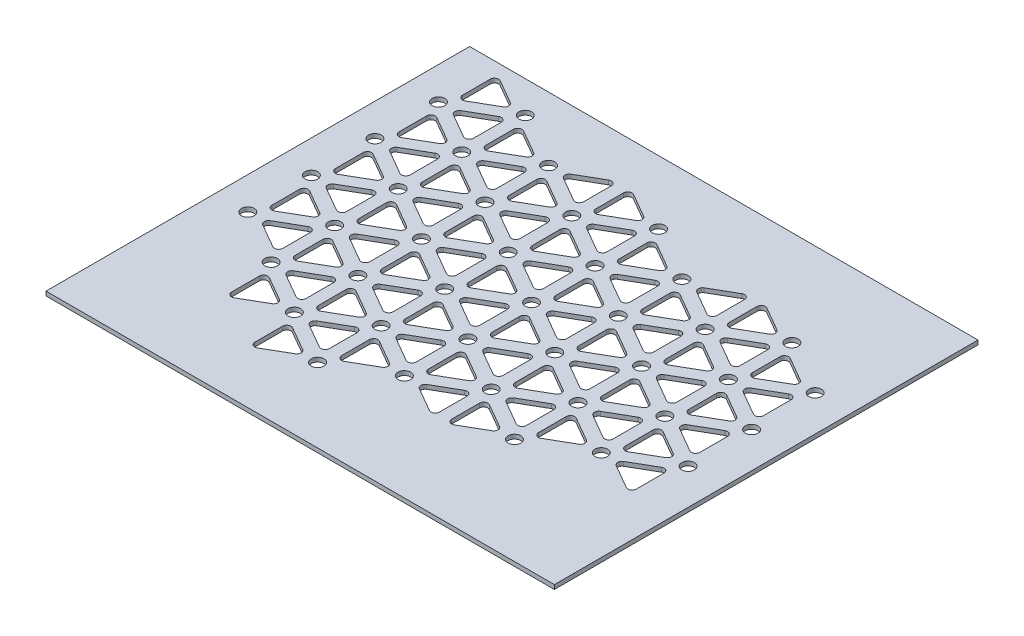
from build123d import *

# Parameters (mm, degrees)
SKETCH1_W               = 120
SKETCH1_H               = 100
BOSS_EXTRUDE1_DEPTH     = 1
CUT_EXTRUDE2_DEPTH      = 85.754448835
FILLET1_R               = 1
CUT_EXTRUDE3_DEPTH      = 85.754448835
FILLET3_R               = 1
SKETCH8_R               = 1.5
CUT_EXTRUDE4_DEPTH      = 85.754448835
FILL_PATTERN2_DEPTH     = 1
FILL_PATTERN3_DEPTH     = 1
FILL_PATTERN4_OUTLINE_R = 1.5
FILL_PATTERN4_DEPTH     = 1


# Read off the part's stored shape, not the designer's step: Fill Pattern2, Fill Pattern3, Fill Pattern4
with BuildPart() as part:
    # Sketch1 → Boss-Extrude1 (new body)
    with BuildSketch(Plane(origin=(0, 0, 0), x_dir=(1, 0, 0), z_dir=(0, 1, 0))):
        with Locations((2.258064516, 7.5)):
            Rectangle(SKETCH1_W, SKETCH1_H)
    extrude(amount=BOSS_EXTRUDE1_DEPTH)

    # Sketch5 → Cut-Extrude2 (cut, through all)
    with BuildSketch(Plane(origin=(0, 1, 0), x_dir=(1, 0, 0), z_dir=(0, 1, 0))):
        Polygon((-39.973726929, 49.978771562), (-48.633980967, 54.978771562), (-48.633980967, 44.978771562), align=None)
    extrude(amount=-CUT_EXTRUDE2_DEPTH, mode=Mode.SUBTRACT)

    # Fillet1
    fillet1_edges = [part.edges().sort_by_distance(p)[0] for p in [
        (-39.973726929, 0.5, -49.978771562),
        (-48.633980967, 0.5, -44.978771562),
        (-48.633980967, 0.5, -54.978771562),
    ]]
    fillet(fillet1_edges, radius=FILLET1_R)

    # Sketch6 → Cut-Extrude3 (cut, through all)
    with BuildSketch(Plane(origin=(0, 1, 0), x_dir=(1, 0, 0), z_dir=(0, 1, 0))):
        Polygon((-47.190605294, 42.478771562), (-38.530351256, 37.478771562), (-38.530351256, 47.478771562), align=None)
    extrude(amount=-CUT_EXTRUDE3_DEPTH, mode=Mode.SUBTRACT)

    # Fillet3
    fillet3_edges = [part.edges().sort_by_distance(p)[0] for p in [
        (-47.190605294, 0.5, -42.478771562),
        (-38.530351256, 0.5, -47.478771562),
        (-38.530351256, 0.5, -37.478771562),
    ]]
    fillet(fillet3_edges, radius=FILLET3_R)

    # Sketch8 → Cut-Extrude4 (cut, through all)
    with BuildSketch(Plane(origin=(0, 1, 0), x_dir=(1, 0, 0), z_dir=(0, 1, 0))):
        with Locations(Location((-37.086975583, 49.978771562, 0), (0, 0, 270))):
            Circle(SKETCH8_R)
    extrude(amount=-CUT_EXTRUDE4_DEPTH, mode=Mode.SUBTRACT)

    # Fill Pattern2 outline → Fill Pattern2 (cut)
    with BuildSketch(Plane(origin=(0, 0, 0), x_dir=(1, 0, 0), z_dir=(0, 1, 0))):
        with BuildLine():
            ThreePointArc((-47.133980967, 24.112746159), (-48.133980967, 24.112746159), (-48.633980967, 23.246720755))
            Line((-48.633980967, 23.246720755), (-48.633980967, 16.71082237))
            ThreePointArc((-48.633980967, 16.71082237), (-48.133980967, 15.844796966), (-47.133980967, 15.844796966))
            Line((-47.133980967, 15.844796966), (-41.473726929, 19.112746159))
            ThreePointArc((-41.473726929, 19.112746159), (-40.973726929, 19.978771563), (-41.473726929, 20.844796966))
            Line((-41.473726929, 20.844796966), (-47.133980967, 24.112746159))
        make_face()
        with BuildLine():
            ThreePointArc((-47.133980967, 9.112746159), (-48.133980967, 9.112746159), (-48.633980967, 8.246720755))
            Line((-48.633980967, 8.246720755), (-48.633980967, 1.71082237))
            ThreePointArc((-48.633980967, 1.71082237), (-48.133980967, 0.844796966), (-47.133980967, 0.844796966))
            Line((-47.133980967, 0.844796966), (-41.473726929, 4.112746159))
            ThreePointArc((-41.473726929, 4.112746159), (-40.973726929, 4.978771562), (-41.473726929, 5.844796966))
            Line((-41.473726929, 5.844796966), (-47.133980967, 9.112746159))
        make_face()
        with BuildLine():
            ThreePointArc((-47.133980967, 39.112746159), (-48.133980967, 39.112746159), (-48.633980967, 38.246720755))
            Line((-48.633980967, 38.246720755), (-48.633980967, 31.71082237))
            ThreePointArc((-48.633980967, 31.71082237), (-48.133980967, 30.844796966), (-47.133980967, 30.844796966))
            Line((-47.133980967, 30.844796966), (-41.473726929, 34.112746159))
            ThreePointArc((-41.473726929, 34.112746159), (-40.973726929, 34.978771563), (-41.473726929, 35.844796966))
            Line((-41.473726929, 35.844796966), (-47.133980967, 39.112746159))
        make_face()
        with BuildLine():
            ThreePointArc((-15.492964815, 34.112746159), (-14.992964815, 34.978771563), (-15.492964815, 35.844796966))
            Line((-15.492964815, 35.844796966), (-21.153218853, 39.112746159))
            ThreePointArc((-21.153218853, 39.112746159), (-22.153218853, 39.112746159), (-22.653218853, 38.246720755))
            Line((-22.653218853, 38.246720755), (-22.653218853, 31.71082237))
            ThreePointArc((-22.653218853, 31.71082237), (-22.153218853, 30.844796966), (-21.153218853, 30.844796966))
            Line((-21.153218853, 30.844796966), (-15.492964815, 34.112746159))
        make_face()
        with BuildLine():
            ThreePointArc((-28.483345872, 41.612746159), (-27.983345872, 42.478771563), (-28.483345872, 43.344796966))
            Line((-28.483345872, 43.344796966), (-34.14359991, 46.612746159))
            ThreePointArc((-34.14359991, 46.612746159), (-35.14359991, 46.612746159), (-35.64359991, 45.746720755))
            Line((-35.64359991, 45.746720755), (-35.64359991, 39.21082237))
            ThreePointArc((-35.64359991, 39.21082237), (-35.14359991, 38.344796966), (-34.14359991, 38.344796966))
            Line((-34.14359991, 38.344796966), (-28.483345872, 41.612746159))
        make_face()
        with BuildLine():
            ThreePointArc((49.458940468, -3.387253841), (49.958940468, -2.521228438), (49.458940468, -1.655203034))
            Line((49.458940468, -1.655203034), (43.798686431, 1.612746159))
            ThreePointArc((43.798686431, 1.612746159), (42.798686431, 1.612746159), (42.298686431, 0.746720755))
            Line((42.298686431, 0.746720755), (42.298686431, -5.78917763))
            ThreePointArc((42.298686431, -5.78917763), (42.798686431, -6.655203034), (43.798686431, -6.655203034))
            Line((43.798686431, -6.655203034), (49.458940468, -3.387253841))
        make_face()
        with BuildLine():
            ThreePointArc((36.468559412, 4.112746159), (36.968559412, 4.978771562), (36.468559412, 5.844796966))
            Line((36.468559412, 5.844796966), (30.808305374, 9.112746159))
            ThreePointArc((30.808305374, 9.112746159), (29.808305374, 9.112746159), (29.308305374, 8.246720755))
            Line((29.308305374, 8.246720755), (29.308305374, 1.71082237))
            ThreePointArc((29.308305374, 1.71082237), (29.808305374, 0.844796966), (30.808305374, 0.844796966))
            Line((30.808305374, 0.844796966), (36.468559412, 4.112746159))
        make_face()
        with BuildLine():
            ThreePointArc((23.478178355, 11.612746159), (23.978178355, 12.478771563), (23.478178355, 13.344796966))
            Line((23.478178355, 13.344796966), (17.817924317, 16.612746159))
            ThreePointArc((17.817924317, 16.612746159), (16.817924317, 16.612746159), (16.317924317, 15.746720755))
            Line((16.317924317, 15.746720755), (16.317924317, 9.21082237))
            ThreePointArc((16.317924317, 9.21082237), (16.817924317, 8.344796966), (17.817924317, 8.344796966))
            Line((17.817924317, 8.344796966), (23.478178355, 11.612746159))
        make_face()
        with BuildLine():
            ThreePointArc((10.487797298, 19.112746159), (10.987797298, 19.978771563), (10.487797298, 20.844796966))
            Line((10.487797298, 20.844796966), (4.82754326, 24.112746159))
            ThreePointArc((4.82754326, 24.112746159), (3.82754326, 24.112746159), (3.32754326, 23.246720755))
            Line((3.32754326, 23.246720755), (3.32754326, 16.71082237))
            ThreePointArc((3.32754326, 16.71082237), (3.82754326, 15.844796966), (4.82754326, 15.844796966))
            Line((4.82754326, 15.844796966), (10.487797298, 19.112746159))
        make_face()
        with BuildLine():
            ThreePointArc((-2.502583759, 26.612746159), (-2.002583759, 27.478771563), (-2.502583759, 28.344796966))
            Line((-2.502583759, 28.344796966), (-8.162837796, 31.612746159))
            ThreePointArc((-8.162837796, 31.612746159), (-9.162837796, 31.612746159), (-9.662837796, 30.746720755))
            Line((-9.662837796, 30.746720755), (-9.662837796, 24.21082237))
            ThreePointArc((-9.662837796, 24.21082237), (-9.162837796, 23.344796966), (-8.162837796, 23.344796966))
            Line((-8.162837796, 23.344796966), (-2.502583759, 26.612746159))
        make_face()
        with BuildLine():
            ThreePointArc((29.308305374, 31.71082237), (29.808305374, 30.844796966), (30.808305374, 30.844796966))
            Line((30.808305374, 30.844796966), (36.468559412, 34.112746159))
            ThreePointArc((36.468559412, 34.112746159), (36.968559412, 34.978771563), (36.468559412, 35.844796966))
            Line((36.468559412, 35.844796966), (30.808305374, 39.112746159))
            ThreePointArc((30.808305374, 39.112746159), (29.808305374, 39.112746159), (29.308305374, 38.246720755))
            Line((29.308305374, 38.246720755), (29.308305374, 31.71082237))
        make_face()
        with BuildLine():
            ThreePointArc((-22.653218853, 1.71082237), (-22.153218853, 0.844796966), (-21.153218853, 0.844796966))
            Line((-21.153218853, 0.844796966), (-15.492964815, 4.112746159))
            ThreePointArc((-15.492964815, 4.112746159), (-14.992964815, 4.978771562), (-15.492964815, 5.844796966))
            Line((-15.492964815, 5.844796966), (-21.153218853, 9.112746159))
            ThreePointArc((-21.153218853, 9.112746159), (-22.153218853, 9.112746159), (-22.653218853, 8.246720755))
            Line((-22.653218853, 8.246720755), (-22.653218853, 1.71082237))
        make_face()
        with BuildLine():
            ThreePointArc((-9.662837796, 9.21082237), (-9.162837796, 8.344796966), (-8.162837796, 8.344796966))
            Line((-8.162837796, 8.344796966), (-2.502583759, 11.612746159))
            ThreePointArc((-2.502583759, 11.612746159), (-2.002583759, 12.478771563), (-2.502583759, 13.344796966))
            Line((-2.502583759, 13.344796966), (-8.162837796, 16.612746159))
            ThreePointArc((-8.162837796, 16.612746159), (-9.162837796, 16.612746159), (-9.662837796, 15.746720755))
            Line((-9.662837796, 15.746720755), (-9.662837796, 9.21082237))
        make_face()
        with BuildLine():
            ThreePointArc((-35.64359991, -5.78917763), (-35.14359991, -6.655203034), (-34.14359991, -6.655203034))
            Line((-34.14359991, -6.655203034), (-28.483345872, -3.387253841))
            ThreePointArc((-28.483345872, -3.387253841), (-27.983345872, -2.521228438), (-28.483345872, -1.655203034))
            Line((-28.483345872, -1.655203034), (-34.14359991, 1.612746159))
            ThreePointArc((-34.14359991, 1.612746159), (-35.14359991, 1.612746159), (-35.64359991, 0.746720755))
            Line((-35.64359991, 0.746720755), (-35.64359991, -5.78917763))
        make_face()
        with BuildLine():
            ThreePointArc((16.317924317, 24.21082237), (16.817924317, 23.344796966), (17.817924317, 23.344796966))
            Line((17.817924317, 23.344796966), (23.478178355, 26.612746159))
            ThreePointArc((23.478178355, 26.612746159), (23.978178355, 27.478771563), (23.478178355, 28.344796966))
            Line((23.478178355, 28.344796966), (17.817924317, 31.612746159))
            ThreePointArc((17.817924317, 31.612746159), (16.817924317, 31.612746159), (16.317924317, 30.746720755))
            Line((16.317924317, 30.746720755), (16.317924317, 24.21082237))
        make_face()
        with BuildLine():
            ThreePointArc((30.808305374, -5.887253841), (29.808305374, -5.887253841), (29.308305374, -6.753279245))
            Line((29.308305374, -6.753279245), (29.308305374, -13.28917763))
            ThreePointArc((29.308305374, -13.28917763), (29.808305374, -14.155203034), (30.808305374, -14.155203034))
            Line((30.808305374, -14.155203034), (36.468559412, -10.887253841))
            ThreePointArc((36.468559412, -10.887253841), (36.968559412, -10.021228437), (36.468559412, -9.155203034))
            Line((36.468559412, -9.155203034), (30.808305374, -5.887253841))
        make_face()
        with BuildLine():
            ThreePointArc((30.808305374, 24.112746159), (29.808305374, 24.112746159), (29.308305374, 23.246720755))
            Line((29.308305374, 23.246720755), (29.308305374, 16.71082237))
            ThreePointArc((29.308305374, 16.71082237), (29.808305374, 15.844796966), (30.808305374, 15.844796966))
            Line((30.808305374, 15.844796966), (36.468559412, 19.112746159))
            ThreePointArc((36.468559412, 19.112746159), (36.968559412, 19.978771563), (36.468559412, 20.844796966))
            Line((36.468559412, 20.844796966), (30.808305374, 24.112746159))
        make_face()
        with BuildLine():
            ThreePointArc((49.458940468, 26.612746159), (49.958940468, 27.478771563), (49.458940468, 28.344796966))
            Line((49.458940468, 28.344796966), (43.798686431, 31.612746159))
            ThreePointArc((43.798686431, 31.612746159), (42.798686431, 31.612746159), (42.298686431, 30.746720755))
            Line((42.298686431, 30.746720755), (42.298686431, 24.21082237))
            ThreePointArc((42.298686431, 24.21082237), (42.798686431, 23.344796966), (43.798686431, 23.344796966))
            Line((43.798686431, 23.344796966), (49.458940468, 26.612746159))
        make_face()
        with BuildLine():
            ThreePointArc((-9.662837796, -5.78917763), (-9.162837796, -6.655203034), (-8.162837796, -6.655203034))
            Line((-8.162837796, -6.655203034), (-2.502583759, -3.387253841))
            ThreePointArc((-2.502583759, -3.387253841), (-2.002583759, -2.521228438), (-2.502583759, -1.655203034))
            Line((-2.502583759, -1.655203034), (-8.162837796, 1.612746159))
            ThreePointArc((-8.162837796, 1.612746159), (-9.162837796, 1.612746159), (-9.662837796, 0.746720755))
            Line((-9.662837796, 0.746720755), (-9.662837796, -5.78917763))
        make_face()
        with BuildLine():
            ThreePointArc((3.32754326, 1.71082237), (3.82754326, 0.844796966), (4.82754326, 0.844796966))
            Line((4.82754326, 0.844796966), (10.487797298, 4.112746159))
            ThreePointArc((10.487797298, 4.112746159), (10.987797298, 4.978771562), (10.487797298, 5.844796966))
            Line((10.487797298, 5.844796966), (4.82754326, 9.112746159))
            ThreePointArc((4.82754326, 9.112746159), (3.82754326, 9.112746159), (3.32754326, 8.246720755))
            Line((3.32754326, 8.246720755), (3.32754326, 1.71082237))
        make_face()
        with BuildLine():
            ThreePointArc((-22.653218853, -13.28917763), (-22.153218853, -14.155203034), (-21.153218853, -14.155203034))
            Line((-21.153218853, -14.155203034), (-15.492964815, -10.887253841))
            ThreePointArc((-15.492964815, -10.887253841), (-14.992964815, -10.021228437), (-15.492964815, -9.155203034))
            Line((-15.492964815, -9.155203034), (-21.153218853, -5.887253841))
            ThreePointArc((-21.153218853, -5.887253841), (-22.153218853, -5.887253841), (-22.653218853, -6.753279245))
            Line((-22.653218853, -6.753279245), (-22.653218853, -13.28917763))
        make_face()
        with BuildLine():
            ThreePointArc((-35.64359991, -20.78917763), (-35.14359991, -21.655203034), (-34.14359991, -21.655203034))
            Line((-34.14359991, -21.655203034), (-28.483345872, -18.387253841))
            ThreePointArc((-28.483345872, -18.387253841), (-27.983345872, -17.521228437), (-28.483345872, -16.655203034))
            Line((-28.483345872, -16.655203034), (-34.14359991, -13.387253841))
            ThreePointArc((-34.14359991, -13.387253841), (-35.14359991, -13.387253841), (-35.64359991, -14.253279245))
            Line((-35.64359991, -14.253279245), (-35.64359991, -20.78917763))
        make_face()
        with BuildLine():
            ThreePointArc((-8.162837796, -13.387253841), (-9.162837796, -13.387253841), (-9.662837796, -14.253279245))
            Line((-9.662837796, -14.253279245), (-9.662837796, -20.78917763))
            ThreePointArc((-9.662837796, -20.78917763), (-9.162837796, -21.655203034), (-8.162837796, -21.655203034))
            Line((-8.162837796, -21.655203034), (-2.502583759, -18.387253841))
            ThreePointArc((-2.502583759, -18.387253841), (-2.002583759, -17.521228437), (-2.502583759, -16.655203034))
            Line((-2.502583759, -16.655203034), (-8.162837796, -13.387253841))
        make_face()
        with BuildLine():
            ThreePointArc((-8.162837796, 46.612746159), (-9.162837796, 46.612746159), (-9.662837796, 45.746720755))
            Line((-9.662837796, 45.746720755), (-9.662837796, 39.21082237))
            ThreePointArc((-9.662837796, 39.21082237), (-9.162837796, 38.344796966), (-8.162837796, 38.344796966))
            Line((-8.162837796, 38.344796966), (-2.502583759, 41.612746159))
            ThreePointArc((-2.502583759, 41.612746159), (-2.002583759, 42.478771563), (-2.502583759, 43.344796966))
            Line((-2.502583759, 43.344796966), (-8.162837796, 46.612746159))
        make_face()
        with BuildLine():
            ThreePointArc((-28.483345872, 11.612746159), (-27.983345872, 12.478771563), (-28.483345872, 13.344796966))
            Line((-28.483345872, 13.344796966), (-34.14359991, 16.612746159))
            ThreePointArc((-34.14359991, 16.612746159), (-35.14359991, 16.612746159), (-35.64359991, 15.746720755))
            Line((-35.64359991, 15.746720755), (-35.64359991, 9.21082237))
            ThreePointArc((-35.64359991, 9.21082237), (-35.14359991, 8.344796966), (-34.14359991, 8.344796966))
            Line((-34.14359991, 8.344796966), (-28.483345872, 11.612746159))
        make_face()
        with BuildLine():
            ThreePointArc((23.478178355, -18.387253841), (23.978178355, -17.521228437), (23.478178355, -16.655203034))
            Line((23.478178355, -16.655203034), (17.817924317, -13.387253841))
            ThreePointArc((17.817924317, -13.387253841), (16.817924317, -13.387253841), (16.317924317, -14.253279245))
            Line((16.317924317, -14.253279245), (16.317924317, -20.78917763))
            ThreePointArc((16.317924317, -20.78917763), (16.817924317, -21.655203034), (17.817924317, -21.655203034))
            Line((17.817924317, -21.655203034), (23.478178355, -18.387253841))
        make_face()
        with BuildLine():
            ThreePointArc((10.487797298, -10.887253841), (10.987797298, -10.021228437), (10.487797298, -9.155203034))
            Line((10.487797298, -9.155203034), (4.82754326, -5.887253841))
            ThreePointArc((4.82754326, -5.887253841), (3.82754326, -5.887253841), (3.32754326, -6.753279245))
            Line((3.32754326, -6.753279245), (3.32754326, -13.28917763))
            ThreePointArc((3.32754326, -13.28917763), (3.82754326, -14.155203034), (4.82754326, -14.155203034))
            Line((4.82754326, -14.155203034), (10.487797298, -10.887253841))
        make_face()
        with BuildLine():
            ThreePointArc((-21.153218853, -20.887253841), (-22.153218853, -20.887253841), (-22.653218853, -21.753279245))
            Line((-22.653218853, -21.753279245), (-22.653218853, -28.28917763))
            ThreePointArc((-22.653218853, -28.28917763), (-22.153218853, -29.155203034), (-21.153218853, -29.155203034))
            Line((-21.153218853, -29.155203034), (-15.492964815, -25.887253841))
            ThreePointArc((-15.492964815, -25.887253841), (-14.992964815, -25.021228437), (-15.492964815, -24.155203034))
            Line((-15.492964815, -24.155203034), (-21.153218853, -20.887253841))
        make_face()
        with BuildLine():
            ThreePointArc((-21.153218853, 24.112746159), (-22.153218853, 24.112746159), (-22.653218853, 23.246720755))
            Line((-22.653218853, 23.246720755), (-22.653218853, 16.71082237))
            ThreePointArc((-22.653218853, 16.71082237), (-22.153218853, 15.844796966), (-21.153218853, 15.844796966))
            Line((-21.153218853, 15.844796966), (-15.492964815, 19.112746159))
            ThreePointArc((-15.492964815, 19.112746159), (-14.992964815, 19.978771563), (-15.492964815, 20.844796966))
            Line((-15.492964815, 20.844796966), (-21.153218853, 24.112746159))
        make_face()
        with BuildLine():
            ThreePointArc((3.32754326, 31.71082237), (3.82754326, 30.844796966), (4.82754326, 30.844796966))
            Line((4.82754326, 30.844796966), (10.487797298, 34.112746159))
            ThreePointArc((10.487797298, 34.112746159), (10.987797298, 34.978771563), (10.487797298, 35.844796966))
            Line((10.487797298, 35.844796966), (4.82754326, 39.112746159))
            ThreePointArc((4.82754326, 39.112746159), (3.82754326, 39.112746159), (3.32754326, 38.246720755))
            Line((3.32754326, 38.246720755), (3.32754326, 31.71082237))
        make_face()
        with BuildLine():
            ThreePointArc((-34.14359991, 31.612746159), (-35.14359991, 31.612746159), (-35.64359991, 30.746720755))
            Line((-35.64359991, 30.746720755), (-35.64359991, 24.21082237))
            ThreePointArc((-35.64359991, 24.21082237), (-35.14359991, 23.344796966), (-34.14359991, 23.344796966))
            Line((-34.14359991, 23.344796966), (-28.483345872, 26.612746159))
            ThreePointArc((-28.483345872, 26.612746159), (-27.983345872, 27.478771563), (-28.483345872, 28.344796966))
            Line((-28.483345872, 28.344796966), (-34.14359991, 31.612746159))
        make_face()
        with BuildLine():
            ThreePointArc((23.478178355, -3.387253841), (23.978178355, -2.521228438), (23.478178355, -1.655203034))
            Line((23.478178355, -1.655203034), (17.817924317, 1.612746159))
            ThreePointArc((17.817924317, 1.612746159), (16.817924317, 1.612746159), (16.317924317, 0.746720755))
            Line((16.317924317, 0.746720755), (16.317924317, -5.78917763))
            ThreePointArc((16.317924317, -5.78917763), (16.817924317, -6.655203034), (17.817924317, -6.655203034))
            Line((17.817924317, -6.655203034), (23.478178355, -3.387253841))
        make_face()
        with BuildLine():
            ThreePointArc((42.298686431, 9.21082237), (42.798686431, 8.344796966), (43.798686431, 8.344796966))
            Line((43.798686431, 8.344796966), (49.458940468, 11.612746159))
            ThreePointArc((49.458940468, 11.612746159), (49.958940468, 12.478771563), (49.458940468, 13.344796966))
            Line((49.458940468, 13.344796966), (43.798686431, 16.612746159))
            ThreePointArc((43.798686431, 16.612746159), (42.798686431, 16.612746159), (42.298686431, 15.746720755))
            Line((42.298686431, 15.746720755), (42.298686431, 9.21082237))
        make_face()
    extrude(amount=FILL_PATTERN2_DEPTH, mode=Mode.SUBTRACT)

    # Fill Pattern3 outline → Fill Pattern3 (cut)
    with BuildSketch(Plane(origin=(0, 0, 0), x_dir=(1, 0, 0), z_dir=(0, 1, 0))):
        with BuildLine():
            ThreePointArc((-40.030351256, 8.344796966), (-39.030351256, 8.344796966), (-38.530351256, 9.21082237))
            Line((-38.530351256, 9.21082237), (-38.530351256, 15.746720755))
            ThreePointArc((-38.530351256, 15.746720755), (-39.030351256, 16.612746159), (-40.030351256, 16.612746159))
            Line((-40.030351256, 16.612746159), (-45.690605294, 13.344796966))
            ThreePointArc((-45.690605294, 13.344796966), (-46.190605294, 12.478771563), (-45.690605294, 11.612746159))
            Line((-45.690605294, 11.612746159), (-40.030351256, 8.344796966))
        make_face()
        with BuildLine():
            ThreePointArc((-40.030351256, -6.655203034), (-39.030351256, -6.655203034), (-38.530351256, -5.78917763))
            Line((-38.530351256, -5.78917763), (-38.530351256, 0.746720755))
            ThreePointArc((-38.530351256, 0.746720755), (-39.030351256, 1.612746159), (-40.030351256, 1.612746159))
            Line((-40.030351256, 1.612746159), (-45.690605294, -1.655203034))
            ThreePointArc((-45.690605294, -1.655203034), (-46.190605294, -2.521228438), (-45.690605294, -3.387253841))
            Line((-45.690605294, -3.387253841), (-40.030351256, -6.655203034))
        make_face()
        with BuildLine():
            ThreePointArc((-40.030351256, 23.344796966), (-39.030351256, 23.344796966), (-38.530351256, 24.21082237))
            Line((-38.530351256, 24.21082237), (-38.530351256, 30.746720755))
            ThreePointArc((-38.530351256, 30.746720755), (-39.030351256, 31.612746159), (-40.030351256, 31.612746159))
            Line((-40.030351256, 31.612746159), (-45.690605294, 28.344796966))
            ThreePointArc((-45.690605294, 28.344796966), (-46.190605294, 27.478771563), (-45.690605294, 26.612746159))
            Line((-45.690605294, 26.612746159), (-40.030351256, 23.344796966))
        make_face()
        with BuildLine():
            ThreePointArc((19.26129999, 5.844796966), (18.76129999, 4.978771562), (19.26129999, 4.112746159))
            Line((19.26129999, 4.112746159), (24.921554028, 0.844796966))
            ThreePointArc((24.921554028, 0.844796966), (25.921554028, 0.844796966), (26.421554028, 1.71082237))
            Line((26.421554028, 1.71082237), (26.421554028, 8.246720755))
            ThreePointArc((26.421554028, 8.246720755), (25.921554028, 9.112746159), (24.921554028, 9.112746159))
            Line((24.921554028, 9.112746159), (19.26129999, 5.844796966))
        make_face()
        with BuildLine():
            ThreePointArc((32.251681047, -1.655203034), (31.751681047, -2.521228438), (32.251681047, -3.387253841))
            Line((32.251681047, -3.387253841), (37.911935085, -6.655203034))
            ThreePointArc((37.911935085, -6.655203034), (38.911935085, -6.655203034), (39.411935085, -5.78917763))
            Line((39.411935085, -5.78917763), (39.411935085, 0.746720755))
            ThreePointArc((39.411935085, 0.746720755), (38.911935085, 1.612746159), (37.911935085, 1.612746159))
            Line((37.911935085, 1.612746159), (32.251681047, -1.655203034))
        make_face()
        with BuildLine():
            ThreePointArc((45.242062104, -9.155203034), (44.742062104, -10.021228437), (45.242062104, -10.887253841))
            Line((45.242062104, -10.887253841), (50.902316141, -14.155203034))
            ThreePointArc((50.902316141, -14.155203034), (51.902316141, -14.155203034), (52.402316141, -13.28917763))
            Line((52.402316141, -13.28917763), (52.402316141, -6.753279245))
            ThreePointArc((52.402316141, -6.753279245), (51.902316141, -5.887253841), (50.902316141, -5.887253841))
            Line((50.902316141, -5.887253841), (45.242062104, -9.155203034))
        make_face()
        with BuildLine():
            ThreePointArc((6.270918933, 13.344796966), (5.770918933, 12.478771563), (6.270918933, 11.612746159))
            Line((6.270918933, 11.612746159), (11.931172971, 8.344796966))
            ThreePointArc((11.931172971, 8.344796966), (12.931172971, 8.344796966), (13.431172971, 9.21082237))
            Line((13.431172971, 9.21082237), (13.431172971, 15.746720755))
            ThreePointArc((13.431172971, 15.746720755), (12.931172971, 16.612746159), (11.931172971, 16.612746159))
            Line((11.931172971, 16.612746159), (6.270918933, 13.344796966))
        make_face()
        with BuildLine():
            ThreePointArc((-6.719462123, 20.844796966), (-7.219462123, 19.978771563), (-6.719462123, 19.112746159))
            Line((-6.719462123, 19.112746159), (-1.059208086, 15.844796966))
            ThreePointArc((-1.059208086, 15.844796966), (-0.059208086, 15.844796966), (0.440791914, 16.71082237))
            Line((0.440791914, 16.71082237), (0.440791914, 23.246720755))
            ThreePointArc((0.440791914, 23.246720755), (-0.059208086, 24.112746159), (-1.059208086, 24.112746159))
            Line((-1.059208086, 24.112746159), (-6.719462123, 20.844796966))
        make_face()
        with BuildLine():
            ThreePointArc((-19.70984318, 28.344796966), (-20.20984318, 27.478771563), (-19.70984318, 26.612746159))
            Line((-19.70984318, 26.612746159), (-14.049589142, 23.344796966))
            ThreePointArc((-14.049589142, 23.344796966), (-13.049589142, 23.344796966), (-12.549589142, 24.21082237))
            Line((-12.549589142, 24.21082237), (-12.549589142, 30.746720755))
            ThreePointArc((-12.549589142, 30.746720755), (-13.049589142, 31.612746159), (-14.049589142, 31.612746159))
            Line((-14.049589142, 31.612746159), (-19.70984318, 28.344796966))
        make_face()
        with BuildLine():
            ThreePointArc((-32.700224237, 35.844796966), (-33.200224237, 34.978771563), (-32.700224237, 34.112746159))
            Line((-32.700224237, 34.112746159), (-27.039970199, 30.844796966))
            ThreePointArc((-27.039970199, 30.844796966), (-26.039970199, 30.844796966), (-25.539970199, 31.71082237))
            Line((-25.539970199, 31.71082237), (-25.539970199, 38.246720755))
            ThreePointArc((-25.539970199, 38.246720755), (-26.039970199, 39.112746159), (-27.039970199, 39.112746159))
            Line((-27.039970199, 39.112746159), (-32.700224237, 35.844796966))
        make_face()
        with BuildLine():
            ThreePointArc((26.421554028, 38.246720755), (25.921554028, 39.112746159), (24.921554028, 39.112746159))
            Line((24.921554028, 39.112746159), (19.26129999, 35.844796966))
            ThreePointArc((19.26129999, 35.844796966), (18.76129999, 34.978771563), (19.26129999, 34.112746159))
            Line((19.26129999, 34.112746159), (24.921554028, 30.844796966))
            ThreePointArc((24.921554028, 30.844796966), (25.921554028, 30.844796966), (26.421554028, 31.71082237))
            Line((26.421554028, 31.71082237), (26.421554028, 38.246720755))
        make_face()
        with BuildLine():
            ThreePointArc((-25.539970199, 8.246720755), (-26.039970199, 9.112746159), (-27.039970199, 9.112746159))
            Line((-27.039970199, 9.112746159), (-32.700224237, 5.844796966))
            ThreePointArc((-32.700224237, 5.844796966), (-33.200224237, 4.978771562), (-32.700224237, 4.112746159))
            Line((-32.700224237, 4.112746159), (-27.039970199, 0.844796966))
            ThreePointArc((-27.039970199, 0.844796966), (-26.039970199, 0.844796966), (-25.539970199, 1.71082237))
            Line((-25.539970199, 1.71082237), (-25.539970199, 8.246720755))
        make_face()
        with BuildLine():
            ThreePointArc((-12.549589142, 15.746720755), (-13.049589142, 16.612746159), (-14.049589142, 16.612746159))
            Line((-14.049589142, 16.612746159), (-19.70984318, 13.344796966))
            ThreePointArc((-19.70984318, 13.344796966), (-20.20984318, 12.478771563), (-19.70984318, 11.612746159))
            Line((-19.70984318, 11.612746159), (-14.049589142, 8.344796966))
            ThreePointArc((-14.049589142, 8.344796966), (-13.049589142, 8.344796966), (-12.549589142, 9.21082237))
            Line((-12.549589142, 9.21082237), (-12.549589142, 15.746720755))
        make_face()
        with BuildLine():
            ThreePointArc((13.431172971, 30.746720755), (12.931172971, 31.612746159), (11.931172971, 31.612746159))
            Line((11.931172971, 31.612746159), (6.270918933, 28.344796966))
            ThreePointArc((6.270918933, 28.344796966), (5.770918933, 27.478771563), (6.270918933, 26.612746159))
            Line((6.270918933, 26.612746159), (11.931172971, 23.344796966))
            ThreePointArc((11.931172971, 23.344796966), (12.931172971, 23.344796966), (13.431172971, 24.21082237))
            Line((13.431172971, 24.21082237), (13.431172971, 30.746720755))
        make_face()
        with BuildLine():
            ThreePointArc((24.921554028, -14.155203034), (25.921554028, -14.155203034), (26.421554028, -13.28917763))
            Line((26.421554028, -13.28917763), (26.421554028, -6.753279245))
            ThreePointArc((26.421554028, -6.753279245), (25.921554028, -5.887253841), (24.921554028, -5.887253841))
            Line((24.921554028, -5.887253841), (19.26129999, -9.155203034))
            ThreePointArc((19.26129999, -9.155203034), (18.76129999, -10.021228437), (19.26129999, -10.887253841))
            Line((19.26129999, -10.887253841), (24.921554028, -14.155203034))
        make_face()
        with BuildLine():
            ThreePointArc((24.921554028, 15.844796966), (25.921554028, 15.844796966), (26.421554028, 16.71082237))
            Line((26.421554028, 16.71082237), (26.421554028, 23.246720755))
            ThreePointArc((26.421554028, 23.246720755), (25.921554028, 24.112746159), (24.921554028, 24.112746159))
            Line((24.921554028, 24.112746159), (19.26129999, 20.844796966))
            ThreePointArc((19.26129999, 20.844796966), (18.76129999, 19.978771563), (19.26129999, 19.112746159))
            Line((19.26129999, 19.112746159), (24.921554028, 15.844796966))
        make_face()
        with BuildLine():
            ThreePointArc((45.242062104, 20.844796966), (44.742062104, 19.978771563), (45.242062104, 19.112746159))
            Line((45.242062104, 19.112746159), (50.902316141, 15.844796966))
            ThreePointArc((50.902316141, 15.844796966), (51.902316141, 15.844796966), (52.402316141, 16.71082237))
            Line((52.402316141, 16.71082237), (52.402316141, 23.246720755))
            ThreePointArc((52.402316141, 23.246720755), (51.902316141, 24.112746159), (50.902316141, 24.112746159))
            Line((50.902316141, 24.112746159), (45.242062104, 20.844796966))
        make_face()
        with BuildLine():
            ThreePointArc((32.251681047, 28.344796966), (31.751681047, 27.478771563), (32.251681047, 26.612746159))
            Line((32.251681047, 26.612746159), (37.911935085, 23.344796966))
            ThreePointArc((37.911935085, 23.344796966), (38.911935085, 23.344796966), (39.411935085, 24.21082237))
            Line((39.411935085, 24.21082237), (39.411935085, 30.746720755))
            ThreePointArc((39.411935085, 30.746720755), (38.911935085, 31.612746159), (37.911935085, 31.612746159))
            Line((37.911935085, 31.612746159), (32.251681047, 28.344796966))
        make_face()
        with BuildLine():
            ThreePointArc((13.431172971, -14.253279245), (12.931172971, -13.387253841), (11.931172971, -13.387253841))
            Line((11.931172971, -13.387253841), (6.270918933, -16.655203034))
            ThreePointArc((6.270918933, -16.655203034), (5.770918933, -17.521228437), (6.270918933, -18.387253841))
            Line((6.270918933, -18.387253841), (11.931172971, -21.655203034))
            ThreePointArc((11.931172971, -21.655203034), (12.931172971, -21.655203034), (13.431172971, -20.78917763))
            Line((13.431172971, -20.78917763), (13.431172971, -14.253279245))
        make_face()
        with BuildLine():
            ThreePointArc((52.402316141, 8.246720755), (51.902316141, 9.112746159), (50.902316141, 9.112746159))
            Line((50.902316141, 9.112746159), (45.242062104, 5.844796966))
            ThreePointArc((45.242062104, 5.844796966), (44.742062104, 4.978771562), (45.242062104, 4.112746159))
            Line((45.242062104, 4.112746159), (50.902316141, 0.844796966))
            ThreePointArc((50.902316141, 0.844796966), (51.902316141, 0.844796966), (52.402316141, 1.71082237))
            Line((52.402316141, 1.71082237), (52.402316141, 8.246720755))
        make_face()
        with BuildLine():
            ThreePointArc((6.270918933, -1.655203034), (5.770918933, -2.521228438), (6.270918933, -3.387253841))
            Line((6.270918933, -3.387253841), (11.931172971, -6.655203034))
            ThreePointArc((11.931172971, -6.655203034), (12.931172971, -6.655203034), (13.431172971, -5.78917763))
            Line((13.431172971, -5.78917763), (13.431172971, 0.746720755))
            ThreePointArc((13.431172971, 0.746720755), (12.931172971, 1.612746159), (11.931172971, 1.612746159))
            Line((11.931172971, 1.612746159), (6.270918933, -1.655203034))
        make_face()
        with BuildLine():
            ThreePointArc((-6.719462123, 5.844796966), (-7.219462123, 4.978771562), (-6.719462123, 4.112746159))
            Line((-6.719462123, 4.112746159), (-1.059208086, 0.844796966))
            ThreePointArc((-1.059208086, 0.844796966), (-0.059208086, 0.844796966), (0.440791914, 1.71082237))
            Line((0.440791914, 1.71082237), (0.440791914, 8.246720755))
            ThreePointArc((0.440791914, 8.246720755), (-0.059208086, 9.112746159), (-1.059208086, 9.112746159))
            Line((-1.059208086, 9.112746159), (-6.719462123, 5.844796966))
        make_face()
        with BuildLine():
            ThreePointArc((-32.700224237, 20.844796966), (-33.200224237, 19.978771563), (-32.700224237, 19.112746159))
            Line((-32.700224237, 19.112746159), (-27.039970199, 15.844796966))
            ThreePointArc((-27.039970199, 15.844796966), (-26.039970199, 15.844796966), (-25.539970199, 16.71082237))
            Line((-25.539970199, 16.71082237), (-25.539970199, 23.246720755))
            ThreePointArc((-25.539970199, 23.246720755), (-26.039970199, 24.112746159), (-27.039970199, 24.112746159))
            Line((-27.039970199, 24.112746159), (-32.700224237, 20.844796966))
        make_face()
        with BuildLine():
            ThreePointArc((0.440791914, 38.246720755), (-0.059208086, 39.112746159), (-1.059208086, 39.112746159))
            Line((-1.059208086, 39.112746159), (-6.719462123, 35.844796966))
            ThreePointArc((-6.719462123, 35.844796966), (-7.219462123, 34.978771563), (-6.719462123, 34.112746159))
            Line((-6.719462123, 34.112746159), (-1.059208086, 30.844796966))
            ThreePointArc((-1.059208086, 30.844796966), (-0.059208086, 30.844796966), (0.440791914, 31.71082237))
            Line((0.440791914, 31.71082237), (0.440791914, 38.246720755))
        make_face()
        with BuildLine():
            ThreePointArc((-19.70984318, -1.655203034), (-20.20984318, -2.521228438), (-19.70984318, -3.387253841))
            Line((-19.70984318, -3.387253841), (-14.049589142, -6.655203034))
            ThreePointArc((-14.049589142, -6.655203034), (-13.049589142, -6.655203034), (-12.549589142, -5.78917763))
            Line((-12.549589142, -5.78917763), (-12.549589142, 0.746720755))
            ThreePointArc((-12.549589142, 0.746720755), (-13.049589142, 1.612746159), (-14.049589142, 1.612746159))
            Line((-14.049589142, 1.612746159), (-19.70984318, -1.655203034))
        make_face()
        with BuildLine():
            ThreePointArc((-6.719462123, -9.155203034), (-7.219462123, -10.021228437), (-6.719462123, -10.887253841))
            Line((-6.719462123, -10.887253841), (-1.059208086, -14.155203034))
            ThreePointArc((-1.059208086, -14.155203034), (-0.059208086, -14.155203034), (0.440791914, -13.28917763))
            Line((0.440791914, -13.28917763), (0.440791914, -6.753279245))
            ThreePointArc((0.440791914, -6.753279245), (-0.059208086, -5.887253841), (-1.059208086, -5.887253841))
            Line((-1.059208086, -5.887253841), (-6.719462123, -9.155203034))
        make_face()
        with BuildLine():
            ThreePointArc((-27.039970199, -14.155203034), (-26.039970199, -14.155203034), (-25.539970199, -13.28917763))
            Line((-25.539970199, -13.28917763), (-25.539970199, -6.753279245))
            ThreePointArc((-25.539970199, -6.753279245), (-26.039970199, -5.887253841), (-27.039970199, -5.887253841))
            Line((-27.039970199, -5.887253841), (-32.700224237, -9.155203034))
            ThreePointArc((-32.700224237, -9.155203034), (-33.200224237, -10.021228437), (-32.700224237, -10.887253841))
            Line((-32.700224237, -10.887253841), (-27.039970199, -14.155203034))
        make_face()
        with BuildLine():
            ThreePointArc((-14.049589142, -21.655203034), (-13.049589142, -21.655203034), (-12.549589142, -20.78917763))
            Line((-12.549589142, -20.78917763), (-12.549589142, -14.253279245))
            ThreePointArc((-12.549589142, -14.253279245), (-13.049589142, -13.387253841), (-14.049589142, -13.387253841))
            Line((-14.049589142, -13.387253841), (-19.70984318, -16.655203034))
            ThreePointArc((-19.70984318, -16.655203034), (-20.20984318, -17.521228437), (-19.70984318, -18.387253841))
            Line((-19.70984318, -18.387253841), (-14.049589142, -21.655203034))
        make_face()
        with BuildLine():
            ThreePointArc((-14.049589142, 38.344796966), (-13.049589142, 38.344796966), (-12.549589142, 39.21082237))
            Line((-12.549589142, 39.21082237), (-12.549589142, 45.746720755))
            ThreePointArc((-12.549589142, 45.746720755), (-13.049589142, 46.612746159), (-14.049589142, 46.612746159))
            Line((-14.049589142, 46.612746159), (-19.70984318, 43.344796966))
            ThreePointArc((-19.70984318, 43.344796966), (-20.20984318, 42.478771563), (-19.70984318, 41.612746159))
            Line((-19.70984318, 41.612746159), (-14.049589142, 38.344796966))
        make_face()
        with BuildLine():
            ThreePointArc((39.411935085, 15.746720755), (38.911935085, 16.612746159), (37.911935085, 16.612746159))
            Line((37.911935085, 16.612746159), (32.251681047, 13.344796966))
            ThreePointArc((32.251681047, 13.344796966), (31.751681047, 12.478771563), (32.251681047, 11.612746159))
            Line((32.251681047, 11.612746159), (37.911935085, 8.344796966))
            ThreePointArc((37.911935085, 8.344796966), (38.911935085, 8.344796966), (39.411935085, 9.21082237))
            Line((39.411935085, 9.21082237), (39.411935085, 15.746720755))
        make_face()
    extrude(amount=FILL_PATTERN3_DEPTH, mode=Mode.SUBTRACT)

    # Fill Pattern4 outline → Fill Pattern4 (cut)
    with BuildSketch(Plane(origin=(0, 0, 0), x_dir=(1, 0, 0), z_dir=(0, 1, 0))):
        with Locations((40.855310758, 34.978771562)):
            Circle(FILL_PATTERN4_OUTLINE_R)
        with Locations((-11.106213469, -25.021228438)):
            Circle(FILL_PATTERN4_OUTLINE_R)
        with Locations((1.884167587, -17.521228438)):
            Circle(FILL_PATTERN4_OUTLINE_R)
        with Locations((-50.07735664, -2.521228438)):
            Circle(FILL_PATTERN4_OUTLINE_R)
        with Locations((-37.086975583, -10.021228438)):
            Circle(FILL_PATTERN4_OUTLINE_R)
        with Locations((-24.096594526, -17.521228438)):
            Circle(FILL_PATTERN4_OUTLINE_R)
        with Locations((1.884167587, 27.478771562)):
            Circle(FILL_PATTERN4_OUTLINE_R)
        with Locations((14.874548644, 19.978771562)):
            Circle(FILL_PATTERN4_OUTLINE_R)
        with Locations((27.864929701, 12.478771562)):
            Circle(FILL_PATTERN4_OUTLINE_R)
        with Locations((40.855310758, 4.978771562)):
            Circle(FILL_PATTERN4_OUTLINE_R)
        with Locations((-24.096594526, 27.478771562)):
            Circle(FILL_PATTERN4_OUTLINE_R)
        with Locations((-37.086975583, 34.978771562)):
            Circle(FILL_PATTERN4_OUTLINE_R)
        with Locations((-50.07735664, 42.478771562)):
            Circle(FILL_PATTERN4_OUTLINE_R)
        with Locations((53.845691814, -2.521228438)):
            Circle(FILL_PATTERN4_OUTLINE_R)
        with Locations((27.864929701, 27.478771562)):
            Circle(FILL_PATTERN4_OUTLINE_R)
        with Locations((14.874548644, 34.978771562)):
            Circle(FILL_PATTERN4_OUTLINE_R)
        with Locations((1.884167587, 42.478771562)):
            Circle(FILL_PATTERN4_OUTLINE_R)
        with Locations((53.845691814, 27.478771562)):
            Circle(FILL_PATTERN4_OUTLINE_R)
        with Locations((40.855310758, 19.978771562)):
            Circle(FILL_PATTERN4_OUTLINE_R)
        with Locations((53.845691814, 12.478771562)):
            Circle(FILL_PATTERN4_OUTLINE_R)
        with Locations((-24.096594526, 42.478771562)):
            Circle(FILL_PATTERN4_OUTLINE_R)
        with Locations((-11.106213469, 34.978771562)):
            Circle(FILL_PATTERN4_OUTLINE_R)
        with Locations((-11.106213469, 4.978771562)):
            Circle(FILL_PATTERN4_OUTLINE_R)
        with Locations((1.884167587, -2.521228438)):
            Circle(FILL_PATTERN4_OUTLINE_R)
        with Locations((14.874548644, -10.021228438)):
            Circle(FILL_PATTERN4_OUTLINE_R)
        with Locations((27.864929701, -17.521228438)):
            Circle(FILL_PATTERN4_OUTLINE_R)
        with Locations((-50.07735664, 12.478771562)):
            Circle(FILL_PATTERN4_OUTLINE_R)
        with Locations((-37.086975583, 4.978771562)):
            Circle(FILL_PATTERN4_OUTLINE_R)
        with Locations((-24.096594526, -2.521228438)):
            Circle(FILL_PATTERN4_OUTLINE_R)
        with Locations((-11.106213469, -10.021228438)):
            Circle(FILL_PATTERN4_OUTLINE_R)
        with Locations((-11.106213469, 19.978771562)):
            Circle(FILL_PATTERN4_OUTLINE_R)
        with Locations((1.884167587, 12.478771562)):
            Circle(FILL_PATTERN4_OUTLINE_R)
        with Locations((14.874548644, 4.978771562)):
            Circle(FILL_PATTERN4_OUTLINE_R)
        with Locations((27.864929701, -2.521228438)):
            Circle(FILL_PATTERN4_OUTLINE_R)
        with Locations((-24.096594526, 12.478771562)):
            Circle(FILL_PATTERN4_OUTLINE_R)
        with Locations((-37.086975583, 19.978771562)):
            Circle(FILL_PATTERN4_OUTLINE_R)
        with Locations((-50.07735664, 27.478771562)):
            Circle(FILL_PATTERN4_OUTLINE_R)
        with Locations((40.855310758, -10.021228438)):
            Circle(FILL_PATTERN4_OUTLINE_R)
    extrude(amount=FILL_PATTERN4_DEPTH, mode=Mode.SUBTRACT)


solid = part.part
